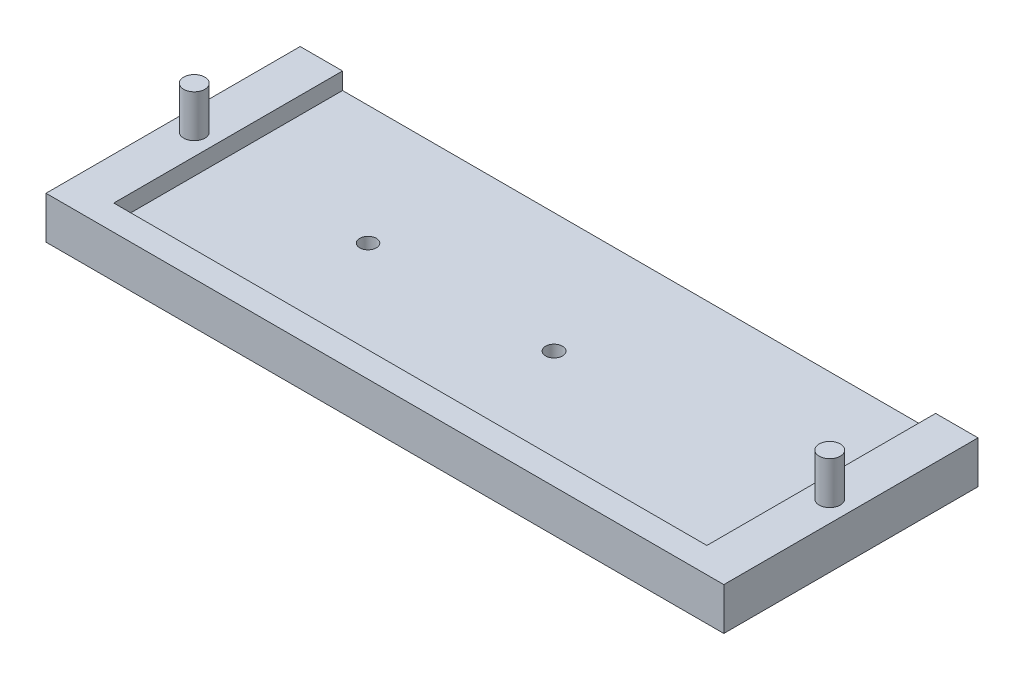
from build123d import *

# Parameters (mm, degrees)
SKETCH1_W           = 203.2
SKETCH1_H           = 76.2
BOSS_EXTRUDE1_DEPTH = 12.7
SKETCH2_W           = 177.8
SKETCH2_H           = 68.58
CUT_EXTRUDE1_DEPTH  = 5.08
SKETCH3_R           = 3.175
BOSS_EXTRUDE3_DEPTH = 12.7
SKETCH4_R           = 3.175
BOSS_EXTRUDE4_DEPTH = 12.7
BOSS_EXTRUDE6_DEPTH = 1.27
SKETCH6_R           = 2.4892
CUT_EXTRUDE2_DEPTH  = 2.54
SKETCH6_2_R         = 2.4892
CUT_EXTRUDE3_DEPTH  = 25.4
SKETCH7_R           = 2.54
CUT_EXTRUDE4_DEPTH  = 25.4


with BuildPart() as part:
    # Sketch1 → Boss-Extrude1 (new body)
    with BuildSketch(Plane(origin=(0, 0, 0), x_dir=(1, 0, 0), z_dir=(0, 1, 0))):
        with Locations((55.88, -8.029677419)):
            Rectangle(SKETCH1_W, SKETCH1_H)
    extrude(amount=BOSS_EXTRUDE1_DEPTH)

    # Sketch2 → Cut-Extrude1 (cut)
    with BuildSketch(Plane(origin=(0, 12.7, 0), x_dir=(1, 0, 0), z_dir=(0, 1, 0))):
        with Locations((55.88, -4.219677419)):
            Rectangle(SKETCH2_W, SKETCH2_H)
    extrude(amount=-CUT_EXTRUDE1_DEPTH, mode=Mode.SUBTRACT)

    # Sketch3 → Boss-Extrude3 (add)
    with BuildSketch(Plane(origin=(0, 12.7, 0), x_dir=(1, 0, 0), z_dir=(0, 1, 0))):
        with Locations((151.13, -8.029677419)):
            Circle(SKETCH3_R)
    extrude(amount=BOSS_EXTRUDE3_DEPTH)

    # Sketch4 → Boss-Extrude4 (add)
    with BuildSketch(Plane(origin=(0, 12.7, 0), x_dir=(1, 0, 0), z_dir=(0, 1, 0))):
        with Locations((-39.37, -8.029677419)):
            Circle(SKETCH4_R)
    extrude(amount=BOSS_EXTRUDE4_DEPTH)

    # Sketch5 → Boss-Extrude6 (add)
    # profile 1 of 10: a face of its own
    with BuildSketch(Plane.XZ):
        Polygon((-9.391608291, 14.673853883), (2.91279663, 14.673853883), (2.91279663, 11.331848883), (2.363124755, 11.331848883), (2.003089677, 12.211323883), (-6.033113135, 12.211323883), (-6.033113135, 8.517528883), (0.958713115, 8.517528883), (1.318748193, 9.240347398), (1.868420068, 9.240347398), (1.868420068, 5.312941851), (1.318748193, 5.312941851), (0.958713115, 6.054998883), (-6.033113135, 6.054998883), (-6.033113135, 1.489973961), (-5.291056104, 1.138183961), (-5.291056104, 0.602253883), (-9.391608291, 0.602253883), (-9.391608291, 1.151925758), (-8.671538135, 1.511960836), (-8.671538135, 13.76414693), (-9.391608291, 14.124182008), align=None)
    # profile 2 of 10: a face of its own
    with BuildSketch(Plane.XZ):
        with BuildLine():
            add(Edge.make_bspline(
                [(10.413069365, 11.331848883), (10.640511021, 11.326668092), (11.088681048, 11.316459431), (11.747633576, 11.232746721), (12.380552993, 11.092470155), (12.982853059, 10.896787293), (13.553060922, 10.65806912), (14.083194172, 10.378866385), (14.571405479, 10.059979909), (15.017664278, 9.705722837), (15.420300143, 9.314640191), (15.777703104, 8.888273039), (16.089323392, 8.426597195), (16.355357657, 7.934788131), (16.566775973, 7.41773445), (16.723028893, 6.884162709), (16.815879998, 6.334005388), (16.827426797, 5.961900401), (16.833236865, 5.774666226)],
                knots=[0, 0, 0, 0, 1.155829405, 2.277542752, 3.370080336, 4.446611411, 5.492251174, 6.508814426, 7.48786546, 8.452231681, 9.400669049, 10.336179665, 11.275172522, 12.227363742, 13.17343163, 14.109266722, 15.048629025, 16, 16, 16, 16], degree=3))
            add(Edge.make_bspline(
                [(16.833236865, 5.774666226), (16.827657659, 5.577348483), (16.816722883, 5.190622279), (16.723770392, 4.623949814), (16.569510866, 4.086652281), (16.357518793, 3.578205897), (16.089013103, 3.10568672), (15.776464047, 2.665802058), (15.420533719, 2.259142322), (15.017632087, 1.889792005), (14.570267063, 1.560879909), (14.083541086, 1.265355986), (13.550455427, 1.019052316), (12.98208352, 0.802997091), (12.378783991, 0.63373496), (11.746297641, 0.513083324), (11.088103444, 0.440783673), (10.640448674, 0.431217747), (10.413069365, 0.426358883)],
                knots=[0, 0, 0, 0, 1.012334393, 1.984090384, 2.938117726, 3.876063098, 4.804625699, 5.721891484, 6.641564794, 7.573443468, 8.521460379, 9.487590958, 10.490973842, 11.531178477, 12.605999305, 13.702541846, 14.833041703, 16, 16, 16, 16], degree=3))
            add(Edge.make_bspline(
                [(10.413069365, 0.426358883), (10.191205554, 0.431477248), (9.753740445, 0.441569503), (9.107426807, 0.510659229), (8.482716259, 0.629227045), (7.880877188, 0.792612621), (7.312020238, 1.003374593), (6.778512867, 1.254551462), (6.286720174, 1.547973353), (5.835932308, 1.882607683), (5.427529831, 2.253402869), (5.066427816, 2.663068164), (4.748364531, 3.104238956), (4.477889742, 3.578848061), (4.2577737, 4.085279078), (4.106442936, 4.624423876), (4.008359373, 5.190271158), (3.998122816, 5.577280053), (3.992901865, 5.774666226)],
                knots=[0, 0, 0, 0, 1.139741516, 2.247311734, 3.3346684, 4.403357891, 5.447218542, 6.447208644, 7.42869796, 8.384113234, 9.326914249, 10.257132352, 11.184488605, 12.116169999, 13.058595031, 14.013442126, 14.986795753, 16, 16, 16, 16], degree=3))
            add(Edge.make_bspline(
                [(3.992901865, 5.774666226), (3.997520521, 5.961951501), (4.006697037, 6.334056785), (4.100646435, 6.882199285), (4.238172975, 7.417934952), (4.441429458, 7.933389212), (4.691918664, 8.427527904), (4.996096795, 8.889533927), (5.351034764, 9.314362068), (5.750921228, 9.706451683), (6.197408843, 10.060859878), (6.687105387, 10.377230799), (7.215802114, 10.658933916), (7.786417058, 10.897078004), (8.393116722, 11.093668118), (9.037318114, 11.233380726), (9.714618064, 11.316588774), (10.177389604, 11.326699635), (10.413069365, 11.331848883)],
                knots=[0, 0, 0, 0, 0.94771798, 1.882961004, 2.809240293, 3.745035667, 4.68302571, 5.610919061, 6.540099325, 7.481811997, 8.442717096, 9.422141996, 10.430956701, 11.472843649, 12.549927822, 13.656668207, 14.806590661, 16, 16, 16, 16], degree=3))
        make_face()
        with BuildLine():
            add(Edge.make_bspline(
                [(10.413069365, 9.221108883), (10.268166931, 9.218209819), (9.981971621, 9.212483908), (9.559710787, 9.158841295), (9.151788461, 9.070349745), (8.760422235, 8.951199317), (8.393111732, 8.798840967), (8.049924482, 8.62645141), (7.734885277, 8.427926819), (7.449384846, 8.20518605), (7.19097366, 7.961876763), (6.963579991, 7.697136317), (6.760278356, 7.414931687), (6.588069986, 7.114267409), (6.448387157, 6.798108268), (6.354458663, 6.468551376), (6.289102146, 6.129945372), (6.28275247, 5.89957535), (6.279536865, 5.782911305)],
                knots=[0, 0, 0, 0, 1.164930638, 2.30084255, 3.41645448, 4.518776829, 5.585970288, 6.610712037, 7.604118549, 8.575338206, 9.518658728, 10.453656181, 11.377792066, 12.311743919, 13.235644819, 14.149532719, 15.062885886, 16, 16, 16, 16], degree=3))
            add(Edge.make_bspline(
                [(6.279536865, 5.782911305), (6.282754662, 5.667167796), (6.289083307, 5.439527724), (6.353344058, 5.107878992), (6.448205791, 4.790184071), (6.587540123, 4.490119434), (6.761413575, 4.207844385), (6.963697836, 3.942351737), (7.192392746, 3.694413984), (7.448901809, 3.464491889), (7.736407188, 3.259034317), (8.050379563, 3.073742576), (8.393718526, 2.915530833), (8.761028654, 2.776665523), (9.152626787, 2.671721118), (9.560519871, 2.59481611), (9.982274102, 2.546862961), (10.268196635, 2.540382458), (10.413069365, 2.537098883)],
                knots=[0, 0, 0, 0, 0.949246105, 1.866942306, 2.76396653, 3.666022835, 4.574236592, 5.481421812, 6.402349294, 7.33999045, 8.30449264, 9.299146383, 10.328877642, 11.404722035, 12.5196688, 13.652687845, 14.810651559, 16, 16, 16, 16], degree=3))
            add(Edge.make_bspline(
                [(10.413069365, 2.537098883), (10.557934486, 2.539408683), (10.842863377, 2.543951727), (11.260769253, 2.589487601), (11.661185644, 2.660823052), (12.044486874, 2.758133322), (12.40522387, 2.888858829), (12.74613769, 3.037268675), (13.0572893, 3.21949723), (13.347942018, 3.418096717), (13.608682076, 3.644921858), (13.843599512, 3.890315002), (14.051948793, 4.155117666), (14.227588876, 4.441995002), (14.373831629, 4.748190813), (14.473890992, 5.077028721), (14.53689244, 5.42411687), (14.543321848, 5.661704149), (14.546601865, 5.782911305)],
                knots=[0, 0, 0, 0, 1.185377714, 2.331467755, 3.436111387, 4.512812234, 5.563504784, 6.573846966, 7.551377038, 8.510323401, 9.451364976, 10.374215357, 11.287726611, 12.203420397, 13.122577102, 14.057052877, 15.008789126, 16, 16, 16, 16], degree=3))
            add(Edge.make_bspline(
                [(14.546601865, 5.782911305), (14.543313154, 5.899555119), (14.536819118, 6.129885193), (14.472475478, 6.469043255), (14.374402463, 6.797726085), (14.234869782, 7.113401113), (14.066589462, 7.416582222), (13.859274703, 7.696871838), (13.629678245, 7.962964061), (13.365745817, 8.204352157), (13.07796657, 8.427275833), (12.762539886, 8.626576524), (12.419933208, 8.798223642), (12.055559243, 8.950762362), (11.668924837, 9.07034783), (11.264710646, 9.159401805), (10.844150874, 9.212396694), (10.557966342, 9.218180504), (10.413069365, 9.221108883)],
                knots=[0, 0, 0, 0, 0.937764472, 1.851751508, 2.768381288, 3.692923377, 4.623881193, 5.552968675, 6.493453576, 7.448193188, 8.425914077, 9.420010015, 10.445462936, 11.506580115, 12.595582612, 13.697560662, 14.834260898, 16, 16, 16, 16], degree=3))
        make_face(mode=Mode.SUBTRACT)
    # profile 3 of 10: a face of its own
    with BuildSketch(Plane.XZ):
        with BuildLine():
            add(Edge.make_bspline(
                [(24.660564365, 11.331848883), (24.888006021, 11.326668092), (25.336176048, 11.316459431), (25.995128576, 11.232746721), (26.628047993, 11.092470155), (27.230348059, 10.896787293), (27.800555922, 10.65806912), (28.330689172, 10.378866385), (28.818900479, 10.059979909), (29.265159278, 9.705722837), (29.667795143, 9.314640191), (30.025198104, 8.888273039), (30.336818392, 8.426597195), (30.602852657, 7.934788131), (30.814270973, 7.41773445), (30.970523893, 6.884162709), (31.063374998, 6.334005388), (31.074921797, 5.961900401), (31.080731865, 5.774666226)],
                knots=[0, 0, 0, 0, 1.155829405, 2.277542752, 3.370080336, 4.446611411, 5.492251174, 6.508814426, 7.48786546, 8.452231681, 9.400669049, 10.336179665, 11.275172522, 12.227363742, 13.17343163, 14.109266722, 15.048629025, 16, 16, 16, 16], degree=3))
            add(Edge.make_bspline(
                [(31.080731865, 5.774666226), (31.075152659, 5.577348483), (31.064217883, 5.190622279), (30.971265392, 4.623949814), (30.817005866, 4.086652281), (30.605013793, 3.578205897), (30.336508103, 3.10568672), (30.023959047, 2.665802058), (29.668028719, 2.259142322), (29.265127087, 1.889792005), (28.817762063, 1.560879909), (28.331036086, 1.265355986), (27.797950427, 1.019052316), (27.22957852, 0.802997091), (26.626278991, 0.63373496), (25.993792641, 0.513083324), (25.335598444, 0.440783673), (24.887943674, 0.431217747), (24.660564365, 0.426358883)],
                knots=[0, 0, 0, 0, 1.012334393, 1.984090384, 2.938117726, 3.876063098, 4.804625699, 5.721891484, 6.641564794, 7.573443468, 8.521460379, 9.487590958, 10.490973842, 11.531178477, 12.605999305, 13.702541846, 14.833041703, 16, 16, 16, 16], degree=3))
            add(Edge.make_bspline(
                [(24.660564365, 0.426358883), (24.438700554, 0.431477248), (24.001235445, 0.441569503), (23.354921807, 0.510659229), (22.730211259, 0.629227045), (22.128372188, 0.792612621), (21.559515238, 1.003374593), (21.026007867, 1.254551462), (20.534215174, 1.547973353), (20.083427308, 1.882607683), (19.675024831, 2.253402869), (19.313922816, 2.663068164), (18.995859531, 3.104238956), (18.725384742, 3.578848061), (18.5052687, 4.085279078), (18.353937936, 4.624423876), (18.255854373, 5.190271158), (18.245617816, 5.577280053), (18.240396865, 5.774666226)],
                knots=[0, 0, 0, 0, 1.139741516, 2.247311734, 3.3346684, 4.403357891, 5.447218542, 6.447208644, 7.42869796, 8.384113234, 9.326914249, 10.257132352, 11.184488605, 12.116169999, 13.058595031, 14.013442126, 14.986795753, 16, 16, 16, 16], degree=3))
            add(Edge.make_bspline(
                [(18.240396865, 5.774666226), (18.245015521, 5.961951501), (18.254192037, 6.334056785), (18.348141435, 6.882199285), (18.485667975, 7.417934952), (18.688924458, 7.933389212), (18.939413664, 8.427527904), (19.243591795, 8.889533927), (19.598529764, 9.314362068), (19.998416228, 9.706451683), (20.444903843, 10.060859878), (20.934600387, 10.377230799), (21.463297114, 10.658933916), (22.033912058, 10.897078004), (22.640611722, 11.093668118), (23.284813114, 11.233380726), (23.962113064, 11.316588774), (24.424884604, 11.326699635), (24.660564365, 11.331848883)],
                knots=[0, 0, 0, 0, 0.94771798, 1.882961004, 2.809240293, 3.745035667, 4.68302571, 5.610919061, 6.540099325, 7.481811997, 8.442717096, 9.422141996, 10.430956701, 11.472843649, 12.549927822, 13.656668207, 14.806590661, 16, 16, 16, 16], degree=3))
        make_face()
        with BuildLine():
            add(Edge.make_bspline(
                [(24.660564365, 9.221108883), (24.515661931, 9.218209819), (24.229466621, 9.212483908), (23.807205787, 9.158841295), (23.399283461, 9.070349745), (23.007917235, 8.951199317), (22.640606732, 8.798840967), (22.297419482, 8.62645141), (21.982380277, 8.427926819), (21.696879846, 8.20518605), (21.43846866, 7.961876763), (21.211074991, 7.697136317), (21.007773356, 7.414931687), (20.835564986, 7.114267409), (20.695882157, 6.798108268), (20.601953663, 6.468551376), (20.536597146, 6.129945372), (20.53024747, 5.89957535), (20.527031865, 5.782911305)],
                knots=[0, 0, 0, 0, 1.164930638, 2.30084255, 3.41645448, 4.518776829, 5.585970288, 6.610712037, 7.604118549, 8.575338206, 9.518658728, 10.453656181, 11.377792066, 12.311743919, 13.235644819, 14.149532719, 15.062885886, 16, 16, 16, 16], degree=3))
            add(Edge.make_bspline(
                [(20.527031865, 5.782911305), (20.530249662, 5.667167796), (20.536578307, 5.439527724), (20.600839058, 5.107878992), (20.695700791, 4.790184071), (20.835035123, 4.490119434), (21.008908575, 4.207844385), (21.211192836, 3.942351737), (21.439887746, 3.694413984), (21.696396809, 3.464491889), (21.983902188, 3.259034317), (22.297874563, 3.073742576), (22.641213526, 2.915530833), (23.008523654, 2.776665523), (23.400121787, 2.671721118), (23.808014871, 2.59481611), (24.229769102, 2.546862961), (24.515691635, 2.540382458), (24.660564365, 2.537098883)],
                knots=[0, 0, 0, 0, 0.949246105, 1.866942306, 2.76396653, 3.666022835, 4.574236592, 5.481421812, 6.402349294, 7.33999045, 8.30449264, 9.299146383, 10.328877642, 11.404722035, 12.5196688, 13.652687845, 14.810651559, 16, 16, 16, 16], degree=3))
            add(Edge.make_bspline(
                [(24.660564365, 2.537098883), (24.805429486, 2.539408683), (25.090358377, 2.543951727), (25.508264253, 2.589487601), (25.908680644, 2.660823052), (26.291981874, 2.758133322), (26.65271887, 2.888858829), (26.99363269, 3.037268675), (27.3047843, 3.21949723), (27.595437018, 3.418096717), (27.856177076, 3.644921858), (28.091094512, 3.890315002), (28.299443793, 4.155117666), (28.475083876, 4.441995002), (28.621326629, 4.748190813), (28.721385992, 5.077028721), (28.78438744, 5.42411687), (28.790816848, 5.661704149), (28.794096865, 5.782911305)],
                knots=[0, 0, 0, 0, 1.185377714, 2.331467755, 3.436111387, 4.512812234, 5.563504784, 6.573846966, 7.551377038, 8.510323401, 9.451364976, 10.374215357, 11.287726611, 12.203420397, 13.122577102, 14.057052877, 15.008789126, 16, 16, 16, 16], degree=3))
            add(Edge.make_bspline(
                [(28.794096865, 5.782911305), (28.790808154, 5.899555119), (28.784314118, 6.129885193), (28.719970478, 6.469043255), (28.621897463, 6.797726085), (28.482364782, 7.113401113), (28.314084462, 7.416582222), (28.106769703, 7.696871838), (27.877173245, 7.962964061), (27.613240817, 8.204352157), (27.32546157, 8.427275833), (27.010034886, 8.626576524), (26.667428208, 8.798223642), (26.303054243, 8.950762362), (25.916419837, 9.07034783), (25.512205646, 9.159401805), (25.091645874, 9.212396694), (24.805461342, 9.218180504), (24.660564365, 9.221108883)],
                knots=[0, 0, 0, 0, 0.937764472, 1.851751508, 2.768381288, 3.692923377, 4.623881193, 5.552968675, 6.493453576, 7.448193188, 8.425914077, 9.420010015, 10.445462936, 11.506580115, 12.595582612, 13.697560662, 14.834260898, 16, 16, 16, 16], degree=3))
        make_face(mode=Mode.SUBTRACT)
    # profile 4 of 10: a face of its own
    with BuildSketch(Plane.XZ):
        with BuildLine():
            Line((32.680277021, 11.155953883), (38.105538427, 11.155953883))
            add(Edge.make_bspline(
                [(38.105538427, 11.155953883), (38.366809171, 11.151447611), (38.873063475, 11.142715982), (39.605740025, 11.068841665), (40.286302741, 10.943392637), (40.913661061, 10.766858757), (41.491392745, 10.55106186), (42.014813892, 10.292345886), (42.488236661, 9.997202674), (42.906557826, 9.660834994), (43.275279172, 9.290143782), (43.594294278, 8.885860921), (43.862752245, 8.446972173), (44.074909026, 7.974485275), (44.244711106, 7.4779396), (44.360482698, 6.957038305), (44.434679306, 6.41533251), (44.44401085, 6.047001039), (44.448751865, 5.859865367)],
                knots=[0, 0, 0, 0, 1.33970646, 2.595897855, 3.771733154, 4.884367228, 5.934137673, 6.930106073, 7.873872972, 8.789611672, 9.676660779, 10.549864961, 11.424950493, 12.308008919, 13.20096117, 14.11164778, 15.040597693, 16, 16, 16, 16], degree=3))
            add(Edge.make_bspline(
                [(44.448751865, 5.859865367), (44.443885498, 5.669889685), (44.434289929, 5.295292974), (44.345862655, 4.746215953), (44.206318708, 4.220714952), (44.010668981, 3.721911015), (43.762359874, 3.252824263), (43.4644687, 2.81676979), (43.117735643, 2.415945387), (42.726826849, 2.049447692), (42.289656517, 1.72124426), (41.808698344, 1.431784143), (41.284303416, 1.182697918), (40.720726338, 0.96987719), (40.116795131, 0.806146177), (39.476981506, 0.689017717), (38.802545198, 0.616300683), (38.341167074, 0.607002514), (38.105538427, 0.602253883)],
                knots=[0, 0, 0, 0, 0.984880268, 1.942000703, 2.87690682, 3.800890493, 4.71502009, 5.624542723, 6.534338461, 7.458945213, 8.398958697, 9.364758676, 10.365923195, 11.406608274, 12.485722888, 13.60704199, 14.777901617, 16, 16, 16, 16], degree=3))
            Line((38.105538427, 0.602253883), (32.680277021, 0.602253883))
            Line((32.680277021, 0.602253883), (32.680277021, 1.154674117))
            Line((32.680277021, 1.154674117), (33.191471865, 1.517457555))
            Line((33.191471865, 1.517457555), (33.191471865, 10.240750211))
            Line((33.191471865, 10.240750211), (32.680277021, 10.603533648))
            Line((32.680277021, 10.603533648), (32.680277021, 11.155953883))
        make_face()
        with BuildLine():
            Line((35.478106865, 9.045213883), (35.478106865, 2.712993883))
            Line((35.478106865, 2.712993883), (38.152260537, 2.712993883))
            add(Edge.make_bspline(
                [(38.152260537, 2.712993883), (38.303537798, 2.71537882), (38.598434565, 2.720027967), (39.028768321, 2.763537021), (39.437482331, 2.826515757), (39.821825881, 2.924379707), (40.182838754, 3.042529384), (40.513142972, 3.192292141), (40.815894706, 3.362924662), (41.088866121, 3.55811177), (41.331710573, 3.776954203), (41.546826004, 4.013204078), (41.732267712, 4.267461502), (41.887465229, 4.539158787), (42.012888349, 4.828798487), (42.099818714, 5.138437489), (42.153772243, 5.464950666), (42.159300347, 5.688336678), (42.162116865, 5.80214982)],
                knots=[0, 0, 0, 0, 1.276888896, 2.489140813, 3.648900505, 4.765152793, 5.834090583, 6.851963703, 7.821949074, 8.764307397, 9.679054604, 10.577134146, 11.457483479, 12.330564547, 13.21420403, 14.11521022, 15.039716742, 16, 16, 16, 16], degree=3))
            add(Edge.make_bspline(
                [(42.162116865, 5.80214982), (42.158726644, 5.911317165), (42.152000607, 6.12789998), (42.104935027, 6.447860156), (42.023827831, 6.757658426), (41.914620432, 7.057416065), (41.773807351, 7.343926646), (41.603808185, 7.61581837), (41.396419943, 7.865275128), (41.166961034, 8.10435258), (40.901037623, 8.319092446), (40.603243292, 8.508735413), (40.272694215, 8.672352463), (39.909181279, 8.805460956), (39.51370564, 8.91217509), (39.087717263, 8.993065954), (38.629470694, 9.034643978), (38.314485399, 9.041620704), (38.152260537, 9.045213883)],
                knots=[0, 0, 0, 0, 0.902337112, 1.790193861, 2.666346385, 3.545635269, 4.422834492, 5.301046515, 6.189290749, 7.099695478, 8.036429392, 9.006991244, 10.012867224, 11.079161619, 12.20165957, 13.395849743, 14.658801144, 16, 16, 16, 16], degree=3))
            Line((38.152260537, 9.045213883), (35.478106865, 9.045213883))
        make_face(mode=Mode.SUBTRACT)
    # profile 5 of 10: a face of its own
    with BuildSketch(Plane.XZ):
        Polygon((45.993329834, 0.602253883), (45.993329834, 1.151925758), (46.735386865, 1.511960836), (46.735386865, 13.76414693), (45.993329834, 14.124182008), (45.993329834, 14.673853883), (50.093882021, 14.673853883), (50.093882021, 14.124182008), (49.373811865, 13.76414693), (49.373811865, 3.064783883), (57.256106552, 3.064783883), (57.635380146, 4.147637476), (58.168561865, 4.147637476), (58.168561865, 0.602253883), align=None)
    # profile 6 of 10: a face of its own
    with BuildSketch(Plane.XZ):
        with BuildLine():
            add(Edge.make_bspline(
                [(65.995889365, 11.331848883), (66.223331021, 11.326668092), (66.671501048, 11.316459431), (67.330453576, 11.232746721), (67.963372993, 11.092470155), (68.565673059, 10.896787293), (69.135880922, 10.65806912), (69.666014172, 10.378866385), (70.154225479, 10.059979909), (70.600484278, 9.705722837), (71.003120143, 9.314640191), (71.360523104, 8.888273039), (71.672143392, 8.426597195), (71.938177657, 7.934788131), (72.149595973, 7.41773445), (72.305848893, 6.884162709), (72.398699998, 6.334005388), (72.410246797, 5.961900401), (72.416056865, 5.774666226)],
                knots=[0, 0, 0, 0, 1.155829405, 2.277542752, 3.370080336, 4.446611411, 5.492251174, 6.508814426, 7.48786546, 8.452231681, 9.400669049, 10.336179665, 11.275172522, 12.227363742, 13.17343163, 14.109266722, 15.048629025, 16, 16, 16, 16], degree=3))
            add(Edge.make_bspline(
                [(72.416056865, 5.774666226), (72.410477659, 5.577348483), (72.399542883, 5.190622279), (72.306590392, 4.623949814), (72.152330866, 4.086652281), (71.940338793, 3.578205897), (71.671833103, 3.10568672), (71.359284047, 2.665802058), (71.003353719, 2.259142322), (70.600452087, 1.889792005), (70.153087063, 1.560879909), (69.666361086, 1.265355986), (69.133275427, 1.019052316), (68.56490352, 0.802997091), (67.961603991, 0.63373496), (67.329117641, 0.513083324), (66.670923444, 0.440783673), (66.223268674, 0.431217747), (65.995889365, 0.426358883)],
                knots=[0, 0, 0, 0, 1.012334393, 1.984090384, 2.938117726, 3.876063098, 4.804625699, 5.721891484, 6.641564794, 7.573443468, 8.521460379, 9.487590958, 10.490973842, 11.531178477, 12.605999305, 13.702541846, 14.833041703, 16, 16, 16, 16], degree=3))
            add(Edge.make_bspline(
                [(65.995889365, 0.426358883), (65.774025554, 0.431477248), (65.336560445, 0.441569503), (64.690246807, 0.510659229), (64.065536259, 0.629227045), (63.463697188, 0.792612621), (62.894840238, 1.003374593), (62.361332867, 1.254551462), (61.869540174, 1.547973353), (61.418752308, 1.882607683), (61.010349831, 2.253402869), (60.649247816, 2.663068164), (60.331184531, 3.104238956), (60.060709742, 3.578848061), (59.8405937, 4.085279078), (59.689262936, 4.624423876), (59.591179373, 5.190271158), (59.580942816, 5.577280053), (59.575721865, 5.774666226)],
                knots=[0, 0, 0, 0, 1.139741516, 2.247311734, 3.3346684, 4.403357891, 5.447218542, 6.447208644, 7.42869796, 8.384113234, 9.326914249, 10.257132352, 11.184488605, 12.116169999, 13.058595031, 14.013442126, 14.986795753, 16, 16, 16, 16], degree=3))
            add(Edge.make_bspline(
                [(59.575721865, 5.774666226), (59.580340521, 5.961951501), (59.589517037, 6.334056785), (59.683466435, 6.882199285), (59.820992975, 7.417934952), (60.024249458, 7.933389212), (60.274738664, 8.427527904), (60.578916795, 8.889533927), (60.933854764, 9.314362068), (61.333741228, 9.706451683), (61.780228843, 10.060859878), (62.269925387, 10.377230799), (62.798622114, 10.658933916), (63.369237058, 10.897078004), (63.975936722, 11.093668118), (64.620138114, 11.233380726), (65.297438064, 11.316588774), (65.760209604, 11.326699635), (65.995889365, 11.331848883)],
                knots=[0, 0, 0, 0, 0.94771798, 1.882961004, 2.809240293, 3.745035667, 4.68302571, 5.610919061, 6.540099325, 7.481811997, 8.442717096, 9.422141996, 10.430956701, 11.472843649, 12.549927822, 13.656668207, 14.806590661, 16, 16, 16, 16], degree=3))
        make_face()
        with BuildLine():
            add(Edge.make_bspline(
                [(65.995889365, 9.221108883), (65.850986931, 9.218209819), (65.564791621, 9.212483908), (65.142530787, 9.158841295), (64.734608461, 9.070349745), (64.343242235, 8.951199317), (63.975931732, 8.798840967), (63.632744482, 8.62645141), (63.317705277, 8.427926819), (63.032204846, 8.20518605), (62.77379366, 7.961876763), (62.546399991, 7.697136317), (62.343098356, 7.414931687), (62.170889986, 7.114267409), (62.031207157, 6.798108268), (61.937278663, 6.468551376), (61.871922146, 6.129945372), (61.86557247, 5.89957535), (61.862356865, 5.782911305)],
                knots=[0, 0, 0, 0, 1.164930638, 2.30084255, 3.41645448, 4.518776829, 5.585970288, 6.610712037, 7.604118549, 8.575338206, 9.518658728, 10.453656181, 11.377792066, 12.311743919, 13.235644819, 14.149532719, 15.062885886, 16, 16, 16, 16], degree=3))
            add(Edge.make_bspline(
                [(61.862356865, 5.782911305), (61.865574662, 5.667167796), (61.871903307, 5.439527724), (61.936164058, 5.107878992), (62.031025791, 4.790184071), (62.170360123, 4.490119434), (62.344233575, 4.207844385), (62.546517836, 3.942351737), (62.775212746, 3.694413984), (63.031721809, 3.464491889), (63.319227188, 3.259034317), (63.633199563, 3.073742576), (63.976538526, 2.915530833), (64.343848654, 2.776665523), (64.735446787, 2.671721118), (65.143339871, 2.59481611), (65.565094102, 2.546862961), (65.851016635, 2.540382458), (65.995889365, 2.537098883)],
                knots=[0, 0, 0, 0, 0.949246105, 1.866942306, 2.76396653, 3.666022835, 4.574236592, 5.481421812, 6.402349294, 7.33999045, 8.30449264, 9.299146383, 10.328877642, 11.404722035, 12.5196688, 13.652687845, 14.810651559, 16, 16, 16, 16], degree=3))
            add(Edge.make_bspline(
                [(65.995889365, 2.537098883), (66.140754486, 2.539408683), (66.425683377, 2.543951727), (66.843589253, 2.589487601), (67.244005644, 2.660823052), (67.627306874, 2.758133322), (67.98804387, 2.888858829), (68.32895769, 3.037268675), (68.6401093, 3.21949723), (68.930762018, 3.418096717), (69.191502076, 3.644921858), (69.426419512, 3.890315002), (69.634768793, 4.155117666), (69.810408876, 4.441995002), (69.956651629, 4.748190813), (70.056710992, 5.077028721), (70.11971244, 5.42411687), (70.126141848, 5.661704149), (70.129421865, 5.782911305)],
                knots=[0, 0, 0, 0, 1.185377714, 2.331467755, 3.436111387, 4.512812234, 5.563504784, 6.573846966, 7.551377038, 8.510323401, 9.451364976, 10.374215357, 11.287726611, 12.203420397, 13.122577102, 14.057052877, 15.008789126, 16, 16, 16, 16], degree=3))
            add(Edge.make_bspline(
                [(70.129421865, 5.782911305), (70.126133154, 5.899555119), (70.119639118, 6.129885193), (70.055295478, 6.469043255), (69.957222463, 6.797726085), (69.817689782, 7.113401113), (69.649409462, 7.416582222), (69.442094703, 7.696871838), (69.212498245, 7.962964061), (68.948565817, 8.204352157), (68.66078657, 8.427275833), (68.345359886, 8.626576524), (68.002753208, 8.798223642), (67.638379243, 8.950762362), (67.251744837, 9.07034783), (66.847530646, 9.159401805), (66.426970874, 9.212396694), (66.140786342, 9.218180504), (65.995889365, 9.221108883)],
                knots=[0, 0, 0, 0, 0.937764472, 1.851751508, 2.768381288, 3.692923377, 4.623881193, 5.552968675, 6.493453576, 7.448193188, 8.425914077, 9.420010015, 10.445462936, 11.506580115, 12.595582612, 13.697560662, 14.834260898, 16, 16, 16, 16], degree=3))
        make_face(mode=Mode.SUBTRACT)
    # profile 7 of 10: a face of its own
    with BuildSketch(Plane.XZ):
        with BuildLine():
            add(Edge.make_bspline(
                [(80.325835146, 11.331848883), (80.45870223, 11.330107076), (80.717292745, 11.326717111), (81.094264912, 11.305072783), (81.449468821, 11.267684724), (81.882901474, 11.193875462), (82.379329169, 11.085216764), (82.841997775, 10.950568883), (83.173884759, 10.829540498), (83.396062304, 10.739557043), (83.598816518, 10.646752631), (83.827587776, 10.519113502), (84.070413346, 10.375029106), (84.241235041, 10.247454617), (84.316452959, 10.191279742)],
                knots=[0, 0, 0, 0, 1.13319622, 2.205465677, 3.21932229, 4.177580476, 5.953921896, 7.551008254, 8.28264322, 8.966043103, 9.595258255, 10.182673561, 11.19977664, 12, 12, 12, 12], degree=3))
            Line((84.316452959, 10.191279742), (84.846886318, 10.41939357))
            Line((84.846886318, 10.41939357), (85.283875459, 10.020881461))
            Line((85.283875459, 10.020881461), (83.137406787, 7.453913805))
            Line((83.137406787, 7.453913805), (82.68117913, 7.852425914))
            Line((82.68117913, 7.852425914), (82.81584874, 8.404846148))
            add(Edge.make_bspline(
                [(82.81584874, 8.404846148), (82.712879415, 8.48037833), (82.512885692, 8.627081849), (82.196664491, 8.804196976), (81.88556318, 8.950587178), (81.568761811, 9.056352393), (81.237795223, 9.13032835), (80.88449314, 9.185848542), (80.500367467, 9.214365806), (80.235179172, 9.218806889), (80.097721318, 9.221108883)],
                knots=[0, 0, 0, 0, 1.056862418, 2.052706966, 2.996658355, 3.901359718, 4.812562165, 5.803188582, 6.861303497, 8, 8, 8, 8], degree=3))
            add(Edge.make_bspline(
                [(80.097721318, 9.221108883), (79.954637094, 9.21831904), (79.674793367, 9.212862673), (79.264411772, 9.158933953), (78.873442434, 9.071438406), (78.50237097, 8.949974156), (78.152499946, 8.801036336), (77.824319042, 8.628583477), (77.519815231, 8.428439816), (77.238331577, 8.20709472), (76.979981288, 7.966277238), (76.757729533, 7.699025048), (76.559458956, 7.416081183), (76.399390498, 7.110286088), (76.268008474, 6.79177977), (76.17870146, 6.460062742), (76.121237359, 6.1202033), (76.113662924, 5.890327619), (76.109851865, 5.774666226)],
                knots=[0, 0, 0, 0, 1.171099257, 2.290432677, 3.382358415, 4.447492189, 5.482726386, 6.492786037, 7.478997963, 8.46195213, 9.422407835, 10.364645224, 11.30308259, 12.246066212, 13.1849532, 14.118550981, 15.053353483, 16, 16, 16, 16], degree=3))
            add(Edge.make_bspline(
                [(76.109851865, 5.774666226), (76.113023272, 5.661650391), (76.119259294, 5.439424428), (76.184499073, 5.114430667), (76.278335104, 4.801022971), (76.418224484, 4.504530531), (76.589413047, 4.223805945), (76.78855789, 3.959847559), (77.011509199, 3.710021049), (77.265061484, 3.48169474), (77.547110614, 3.277301648), (77.849820174, 3.087171349), (78.181139413, 2.927508945), (78.532134873, 2.786552114), (78.903207236, 2.673253623), (79.289786456, 2.594925366), (79.689748695, 2.546757152), (79.960166642, 2.540355327), (80.097721318, 2.537098883)],
                knots=[0, 0, 0, 0, 0.951570711, 1.871098134, 2.784800452, 3.704035874, 4.625993042, 5.552854959, 6.488078842, 7.445119563, 8.423002811, 9.421861085, 10.454693105, 11.518931916, 12.608679191, 13.720537963, 14.840496113, 16, 16, 16, 16], degree=3))
            add(Edge.make_bspline(
                [(80.097721318, 2.537098883), (80.285570408, 2.539979846), (80.637826935, 2.545382258), (81.131157339, 2.578102424), (81.553058041, 2.639909597), (81.910084602, 2.724948145), (82.213097719, 2.832538152), (82.476240586, 2.950344682), (82.708844335, 3.075780847), (82.844266085, 3.174187445), (82.909292959, 3.221440367)],
                knots=[0, 0, 0, 0, 1.530000542, 2.869072598, 4.023462491, 4.99885545, 5.853089347, 6.637935066, 7.345963083, 8, 8, 8, 8], degree=3))
            Line((82.909292959, 3.221440367), (82.796610224, 3.828827789))
            Line((82.796610224, 3.828827789), (83.250089521, 4.153134195))
            Line((83.250089521, 4.153134195), (85.380068037, 1.630140289))
            Line((85.380068037, 1.630140289), (84.978807568, 1.278350289))
            Line((84.978807568, 1.278350289), (84.35218163, 1.517457555))
            add(Edge.make_bspline(
                [(84.35218163, 1.517457555), (84.180309754, 1.435165309), (83.847521866, 1.275826487), (83.353379938, 1.05456536), (82.867430713, 0.86199699), (82.376990119, 0.697218866), (81.868415936, 0.569294161), (81.427961332, 0.495449506), (81.055456279, 0.459751944), (80.753815206, 0.442003423), (80.432264338, 0.426220795), (80.211342232, 0.426311984), (80.097721318, 0.426358883)],
                knots=[0, 0, 0, 0, 1.286720858, 2.491420502, 3.655095554, 4.815131102, 5.982401527, 7.192615714, 7.826621679, 8.50846761, 9.232900333, 10, 10, 10, 10], degree=3))
            add(Edge.make_bspline(
                [(80.097721318, 0.426358883), (79.876738199, 0.431164801), (79.440931204, 0.440642688), (78.798651884, 0.514139953), (78.178211007, 0.631560064), (77.583359143, 0.795794211), (77.020556484, 1.002518956), (76.498650333, 1.254298736), (76.017126948, 1.542215836), (75.580865674, 1.87378649), (75.188979403, 2.243751139), (74.840948288, 2.648672697), (74.539470553, 3.090954929), (74.279456716, 3.564881958), (74.076089504, 4.075349647), (73.930725466, 4.614794518), (73.840315413, 5.181652725), (73.828986045, 5.569115842), (73.823216865, 5.766421148)],
                knots=[0, 0, 0, 0, 1.147577063, 2.263168853, 3.353188382, 4.424507993, 5.464860899, 6.463016853, 7.430052485, 8.374139023, 9.303188064, 10.224466595, 11.141767312, 12.078643255, 13.026762401, 13.988315242, 14.975602943, 16, 16, 16, 16], degree=3))
            add(Edge.make_bspline(
                [(73.823216865, 5.766421148), (73.827578089, 5.964565012), (73.836173219, 6.355068228), (73.915839007, 6.928255646), (74.041803209, 7.477640589), (74.21634271, 8.002059657), (74.445965775, 8.493558923), (74.718220656, 8.954432436), (75.041684167, 9.376426319), (75.413791818, 9.762142096), (75.837968609, 10.112540797), (76.322347679, 10.418899676), (76.861996216, 10.689084642), (77.456512648, 10.918358992), (78.102968267, 11.106867208), (78.801846882, 11.235527139), (79.547964492, 11.316690459), (80.061771954, 11.326703064), (80.325835146, 11.331848883)],
                knots=[0, 0, 0, 0, 0.98102092, 1.933402419, 2.860241606, 3.770027652, 4.665371914, 5.542441092, 6.416464575, 7.292594127, 8.192011416, 9.134842402, 10.125180724, 11.176860481, 12.286996777, 13.455546484, 14.692318491, 16, 16, 16, 16], degree=3))
        make_face()
    # profile 8 of 10: a face of its own
    with BuildSketch(Plane.XZ):
        Polygon((87.364383505, 0.602253883), (87.364383505, 1.154674117), (87.894816865, 1.517457555), (87.894816865, 10.221511695), (87.364383505, 10.603533648), (87.364383505, 11.155953883), (90.695395068, 11.155953883), (90.695395068, 10.603533648), (90.181451865, 10.221511695), (90.181451865, 6.755830523), (94.38094499, 10.298465758), (94.075877099, 10.603533648), (94.075877099, 11.155953883), (98.143448974, 11.155953883), (98.143448974, 10.603533648), (97.211755146, 10.240750211), (93.468489677, 7.154342633), (97.857619599, 1.517457555), (98.750836396, 1.154674117), (98.750836396, 0.602253883), (94.589820302, 0.602253883), (94.589820302, 1.09695857), (95.139492177, 1.476232164), (91.987123974, 5.656486773), (90.181451865, 4.268565289), (90.181451865, 1.514709195), (90.695395068, 1.151925758), (90.695395068, 0.602253883), align=None)
    # profile 9 of 10: a face of its own
    with BuildSketch(Plane.XZ):
        Polygon((100.028823505, 11.155953883), (109.249569209, 11.155953883), (109.249569209, 8.245441305), (108.661420302, 8.245441305), (108.394829443, 9.045213883), (102.845891865, 9.045213883), (102.845891865, 7.110368883), (107.61429538, 7.110368883), (107.88088624, 7.643550601), (108.433306474, 7.643550601), (108.433306474, 4.66158068), (107.88088624, 4.66158068), (107.61429538, 5.175523883), (102.845891865, 5.175523883), (102.845891865, 2.712993883), (108.545989209, 2.712993883), (108.831818584, 3.529256617), (109.381490459, 3.529256617), (109.381490459, 0.602253883), (100.028823505, 0.602253883), (100.028823505, 1.154674117), (100.559256865, 1.517457555), (100.559256865, 10.240750211), (100.028823505, 10.603533648), align=None)
    # profile 10 of 10: a face of its own
    with BuildSketch(Plane.XZ):
        with BuildLine():
            Line((111.481237021, 11.155953883), (117.920643037, 11.155953883))
            add(Edge.make_bspline(
                [(117.920643037, 11.155953883), (118.072834554, 11.153724229), (118.368734542, 11.149389201), (118.798620441, 11.104157799), (119.201899115, 11.032993187), (119.579289798, 10.936548588), (119.928648319, 10.804355941), (120.254294278, 10.650647592), (120.550219744, 10.460495803), (120.820401908, 10.247176098), (121.060057598, 10.006521232), (121.270932148, 9.74490246), (121.447173505, 9.458856299), (121.594803565, 9.151840678), (121.706262213, 8.821118518), (121.786488048, 8.468522397), (121.83274961, 8.094599414), (121.839237614, 7.837894711), (121.842551865, 7.706762867)],
                knots=[0, 0, 0, 0, 1.232111207, 2.395545415, 3.495759669, 4.546667155, 5.544376776, 6.516604472, 7.457179353, 8.38642106, 9.299228464, 10.201818289, 11.101476231, 12.014042407, 12.954851334, 13.921315653, 14.938150693, 16, 16, 16, 16], degree=3))
            add(Edge.make_bspline(
                [(121.842551865, 7.706762867), (121.841261783, 7.619647679), (121.838715627, 7.447713683), (121.809891881, 7.19614418), (121.766926674, 6.9540701), (121.70236254, 6.723016741), (121.624132209, 6.499538333), (121.52386529, 6.287928625), (121.408900209, 6.085377248), (121.227384751, 5.833857867), (120.969471258, 5.539801873), (120.60933886, 5.232141456), (120.203972452, 4.962870589), (119.906126965, 4.825355005), (119.75379874, 4.755024898)],
                knots=[0, 0, 0, 0, 0.813765209, 1.606079345, 2.363437399, 3.109090568, 3.845693792, 4.573436732, 5.294501133, 6.019064268, 7.468822697, 8.937943403, 10.433961, 12, 12, 12, 12], degree=3))
            Line((119.75379874, 4.755024898), (122.202586943, 1.517457555))
            Line((122.202586943, 1.517457555), (122.944643974, 1.154674117))
            Line((122.944643974, 1.154674117), (122.944643974, 0.602253883))
            Line((122.944643974, 0.602253883), (119.113431005, 0.602253883))
            Line((119.113431005, 0.602253883), (119.113431005, 1.14093232))
            Line((119.113431005, 1.14093232), (119.380021865, 1.49547068))
            Line((119.380021865, 1.49547068), (117.560607959, 4.120153883))
            Line((117.560607959, 4.120153883), (114.279066865, 4.120153883))
            Line((114.279066865, 4.120153883), (114.279066865, 1.49547068))
            Line((114.279066865, 1.49547068), (114.831487099, 1.14093232))
            Line((114.831487099, 1.14093232), (114.831487099, 0.602253883))
            Line((114.831487099, 0.602253883), (111.481237021, 0.602253883))
            Line((111.481237021, 0.602253883), (111.481237021, 1.154674117))
            Line((111.481237021, 1.154674117), (111.992431865, 1.517457555))
            Line((111.992431865, 1.517457555), (111.992431865, 10.240750211))
            Line((111.992431865, 10.240750211), (111.481237021, 10.603533648))
            Line((111.481237021, 10.603533648), (111.481237021, 11.155953883))
        make_face()
        with BuildLine():
            Line((114.279066865, 9.045213883), (114.279066865, 6.230893883))
            Line((114.279066865, 6.230893883), (117.541369443, 6.230893883))
            add(Edge.make_bspline(
                [(117.541369443, 6.230893883), (117.679056379, 6.234834912), (117.945134199, 6.242450888), (118.326273084, 6.308478381), (118.671777346, 6.418454065), (118.931290228, 6.54683448), (119.113517289, 6.672502088), (119.234024906, 6.776596319), (119.332457094, 6.896927713), (119.417360311, 7.02540511), (119.47600976, 7.169215466), (119.524406168, 7.320264048), (119.552160894, 7.484972681), (119.55463671, 7.598560333), (119.555916865, 7.657292398)],
                knots=[0, 0, 0, 0, 1.783318707, 3.446235125, 4.993050938, 6.469041305, 7.177089553, 7.858355663, 8.524136429, 9.186095718, 9.845495052, 10.528929982, 11.239362907, 12, 12, 12, 12], degree=3))
            add(Edge.make_bspline(
                [(119.555916865, 7.657292398), (119.554549996, 7.71235816), (119.551866415, 7.820469083), (119.524402432, 7.97792085), (119.476035427, 8.123504058), (119.417187116, 8.261832771), (119.332536343, 8.385063677), (119.232190781, 8.499727898), (119.113734124, 8.603800059), (118.931157373, 8.729154187), (118.671825217, 8.857696614), (118.326259005, 8.967616763), (117.945138131, 9.033660402), (117.67905772, 9.041274056), (117.541369443, 9.045213883)],
                knots=[0, 0, 0, 0, 0.722423355, 1.418337896, 2.087665974, 2.733574839, 3.383945995, 4.040072761, 4.730144437, 5.447344418, 6.942412399, 8.509221264, 10.19363137, 12, 12, 12, 12], degree=3))
            Line((117.541369443, 9.045213883), (114.279066865, 9.045213883))
        make_face(mode=Mode.SUBTRACT)
    extrude(amount=BOSS_EXTRUDE6_DEPTH)

    # Sketch6 → Cut-Extrude2 (cut)
    with BuildSketch(Plane.XZ):
        with Locations((10.404917952, 5.714519439)):
            Circle(SKETCH6_R)
    extrude(amount=-CUT_EXTRUDE2_DEPTH, mode=Mode.SUBTRACT)

    # Sketch6<2> → Cut-Extrude3 (cut)
    with BuildSketch(Plane.XZ):
        with Locations((10.404917952, 5.714519439)):
            Circle(SKETCH6_2_R)
    extrude(amount=-CUT_EXTRUDE3_DEPTH, mode=Mode.SUBTRACT)

    # Sketch7 → Cut-Extrude4 (cut)
    with BuildSketch(Plane.XZ):
        with Locations((66.320367301, 5.867783749)):
            Circle(SKETCH7_R)
    extrude(amount=-CUT_EXTRUDE4_DEPTH, mode=Mode.SUBTRACT)


solid = part.part
